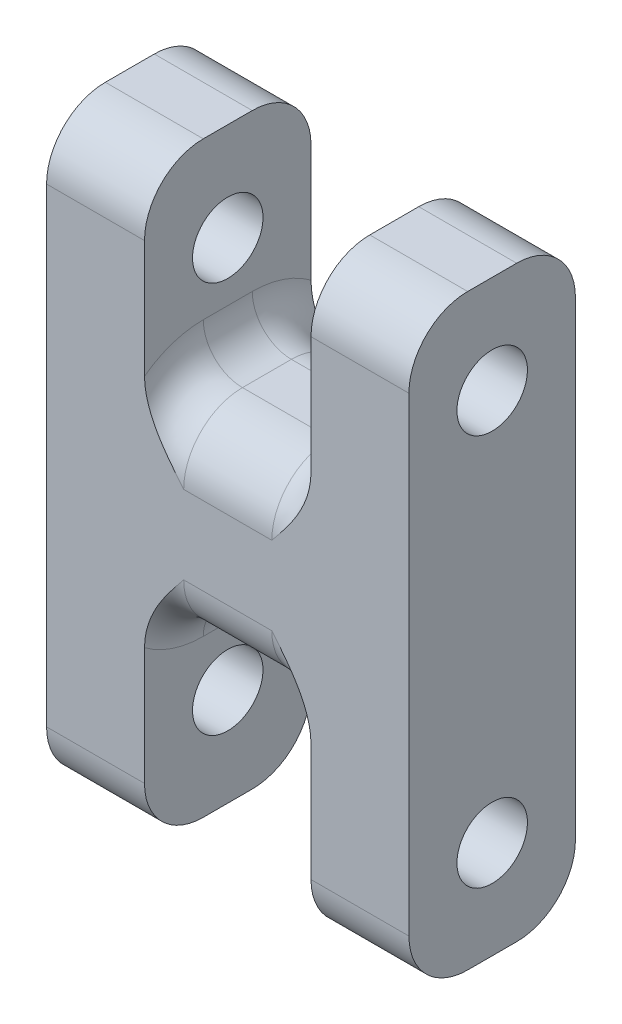
from build123d import *

# Parameters (mm, degrees)
ESQUISSE1_W             = 5
ESQUISSE1_H             = 30
ESQUISSE1_W_2           = 8.5
ESQUISSE1_H_2           = 10
BOSS_EXTRU_1_DEPTH      = 8.5
ESQUISSE2_R             = 1.8
ENL_V_MAT_EXTRU_1_DEPTH = 20
CONG_3_R                = 3
CONG_1_R                = 2


with BuildPart() as part:
    # Esquisse1 → Boss.-Extru.1 (new body)
    with BuildSketch(Plane.XY):
        with Locations((2.5, 15)):
            Rectangle(ESQUISSE1_W, ESQUISSE1_H)
        with Locations((16, 15)):
            Rectangle(ESQUISSE1_W, ESQUISSE1_H)
        with Locations((9.25, 15)):
            Rectangle(ESQUISSE1_W_2, ESQUISSE1_H_2)
    extrude(amount=BOSS_EXTRU_1_DEPTH)

    # Esquisse2 → Enlèv. mat.-Extru.1 (cut)
    with BuildSketch(Plane(origin=(18.5, 0, 0), x_dir=(0, 0, -1), z_dir=(1, 0, 0))):
        with Locations(Location((-4.25, 25, 0), (0, 0, 90))):
            Circle(ESQUISSE2_R)
        with Locations(Location((-4.25, 5, 0), (0, 0, 90))):
            Circle(ESQUISSE2_R)
    extrude(amount=-ENL_V_MAT_EXTRU_1_DEPTH, mode=Mode.SUBTRACT)

    # Congé3
    cong_3_edges = [part.edges().sort_by_distance(p)[0] for p in [
        (2.5, 30, 8.5),
        (9.25, 20, 0),
        (16, 30, 0),
        (16, 0, 0),
        (9.25, 10, 0),
        (2.5, 0, 0),
        (2.5, 30, 0),
        (2.5, 0, 8.5),
        (9.25, 10, 8.5),
        (16, 0, 8.5),
        (16, 30, 8.5),
        (9.25, 20, 8.5),
    ]]
    fillet(cong_3_edges, radius=CONG_3_R)

    # Congé1
    # the kernel refuses this fillet: 2 mm, written as the material it adds along each edge
    with BuildSketch(Plane(origin=(13.5, 10, 3), x_dir=(0, -1, 0), z_dir=(0, 0, 1)), Plane(origin=(5, 20, 3), x_dir=(0, 1, 0), z_dir=(0, 0, 1))) as cong_1_piece_1:
        with BuildLine():
            CenterArc((CONG_1_R, -CONG_1_R), CONG_1_R, 90, 90)
            Line((0, -CONG_1_R), (0, 0))
            Line((0, 0), (CONG_1_R, 0))
        make_face()
    extrude(amount=2.5)
    with BuildSketch(Plane(origin=(13.5, 17, 3), x_dir=(0, -0.9953436464450918, 0.09638996566753391), z_dir=(0, 0.09638996566753391, 0.9953436464450918))) as cong_1_piece_2_section:
        with BuildLine():
            CenterArc((3 + CONG_1_R, -CONG_1_R), CONG_1_R, 90, 90)
            Line((3, -CONG_1_R), (3, 0))
            Line((3, 0), (3 + CONG_1_R, 0))
        make_face()
    cong_1_piece_2 = revolve(axis=Axis((13.5, 17, 3), (1, 0, 0)), revolution_arc=185.531326158, mode=Mode.PRIVATE)
    cong_1_piece_2 = split(cong_1_piece_2, bisect_by=Plane(origin=(12.926399559, 19.220886719, 0), z_dir=(0, 0, 1)), keep=Keep.TOP, mode=Mode.PRIVATE)
    add(cong_1_piece_2)
    with BuildSketch(Plane(origin=(5, 17, 3), x_dir=(0, -0.9953436464450918, 0.09638996566753227), z_dir=(0, 0.09638996566753227, 0.9953436464450918))) as cong_1_piece_3_section:
        with BuildLine():
            CenterArc((3 + CONG_1_R, CONG_1_R), CONG_1_R, 180, 90)
            Line((3 + CONG_1_R, 0), (3, 0))
            Line((3, 0), (3, CONG_1_R))
        make_face()
    cong_1_piece_3 = revolve(axis=Axis((5, 17, 3), (1, 0, 0)), revolution_arc=185.531326158, mode=Mode.PRIVATE)
    cong_1_piece_3 = split(cong_1_piece_3, bisect_by=Plane(origin=(5.573600437, 19.220886663, 0), z_dir=(0, 0, 1)), keep=Keep.TOP, mode=Mode.PRIVATE)
    add(cong_1_piece_3)
    with BuildSketch(Plane(origin=(13.5, 13, 3), x_dir=(0, 0.9953436464450918, 0.09638996566753272), z_dir=(0, -0.09638996566753272, 0.9953436464450918))) as cong_1_piece_4_section:
        with BuildLine():
            CenterArc((3 + CONG_1_R, CONG_1_R), CONG_1_R, 180, 90)
            Line((3 + CONG_1_R, 0), (3, 0))
            Line((3, 0), (3, CONG_1_R))
        make_face()
    cong_1_piece_4 = revolve(axis=Axis((13.5, 13, 3), (-1, 0, 0)), revolution_arc=185.531326158, mode=Mode.PRIVATE)
    cong_1_piece_4 = split(cong_1_piece_4, bisect_by=Plane(origin=(12.926399561, 10.779113284, 0), z_dir=(0, 0, 1)), keep=Keep.TOP, mode=Mode.PRIVATE)
    add(cong_1_piece_4)
    with BuildSketch(Plane(origin=(5, 13, 3), x_dir=(0, 0.9953436464450918, 0.09638996566753391), z_dir=(0, -0.09638996566753391, 0.9953436464450918))) as cong_1_piece_5_section:
        with BuildLine():
            CenterArc((3 + CONG_1_R, -CONG_1_R), CONG_1_R, 90, 90)
            Line((3, -CONG_1_R), (3, 0))
            Line((3, 0), (3 + CONG_1_R, 0))
        make_face()
    cong_1_piece_5 = revolve(axis=Axis((5, 13, 3), (-1, 0, 0)), revolution_arc=185.531326158, mode=Mode.PRIVATE)
    cong_1_piece_5 = split(cong_1_piece_5, bisect_by=Plane(origin=(5.573600429, 10.779113281, 0), z_dir=(0, 0, 1)), keep=Keep.TOP, mode=Mode.PRIVATE)
    add(cong_1_piece_5)
    with BuildSketch(Plane(origin=(13.5, 17, 5.5), x_dir=(0, -0.9953436464450917, -0.09638996566753434), z_dir=(0, 0.09638996566753434, -0.9953436464450917))) as cong_1_piece_6_section:
        with BuildLine():
            CenterArc((3 + CONG_1_R, CONG_1_R), CONG_1_R, 180, 90)
            Line((3, CONG_1_R), (3, 0))
            Line((3, 0), (3 + CONG_1_R, 0))
        make_face()
    cong_1_piece_6 = revolve(axis=Axis((13.5, 17, 5.5), (-1, 0, 0)), revolution_arc=185.531326158, mode=Mode.PRIVATE)
    cong_1_piece_6 = split(cong_1_piece_6, bisect_by=Plane(origin=(12.92639966, 19.220886752, 8.5), z_dir=(0, 0, -1)), keep=Keep.TOP, mode=Mode.PRIVATE)
    add(cong_1_piece_6)
    with BuildSketch(Plane(origin=(5, 17, 5.5), x_dir=(0, -0.9953436464450918, -0.09638996566753258), z_dir=(0, 0.09638996566753258, -0.9953436464450918))) as cong_1_piece_7_section:
        with BuildLine():
            CenterArc((3 + CONG_1_R, -CONG_1_R), CONG_1_R, 90, 90)
            Line((3, -CONG_1_R), (3, 0))
            Line((3, 0), (3 + CONG_1_R, 0))
        make_face()
    cong_1_piece_7 = revolve(axis=Axis((5, 17, 5.5), (-1, 0, 0)), revolution_arc=185.531326158, mode=Mode.PRIVATE)
    cong_1_piece_7 = split(cong_1_piece_7, bisect_by=Plane(origin=(5.573251137, 19.22118781, 8.5), z_dir=(0, 0, -1)), keep=Keep.TOP, mode=Mode.PRIVATE)
    add(cong_1_piece_7)
    with BuildSketch(Plane(origin=(13.5, 13, 5.5), x_dir=(0, 0.9953436464450918, -0.09638996566753316), z_dir=(0, -0.09638996566753316, -0.9953436464450918))) as cong_1_piece_8_section:
        with BuildLine():
            CenterArc((3 + CONG_1_R, -CONG_1_R), CONG_1_R, 90, 90)
            Line((3, -CONG_1_R), (3, 0))
            Line((3, 0), (3 + CONG_1_R, 0))
        make_face()
    cong_1_piece_8 = revolve(axis=Axis((13.5, 13, 5.5), (1, 0, 0)), revolution_arc=185.531326158, mode=Mode.PRIVATE)
    cong_1_piece_8 = split(cong_1_piece_8, bisect_by=Plane(origin=(12.926652362, 10.77922389, 8.5), z_dir=(0, 0, -1)), keep=Keep.TOP, mode=Mode.PRIVATE)
    add(cong_1_piece_8)
    with BuildSketch(Plane(origin=(5, 13, 5.5), x_dir=(0, 0.9953436464450917, -0.09638996566753434), z_dir=(0, -0.09638996566753434, -0.9953436464450917))) as cong_1_piece_9_section:
        with BuildLine():
            CenterArc((3 + CONG_1_R, CONG_1_R), CONG_1_R, 180, 90)
            Line((3, CONG_1_R), (3, 0))
            Line((3, 0), (3 + CONG_1_R, 0))
        make_face()
    cong_1_piece_9 = revolve(axis=Axis((5, 13, 5.5), (1, 0, 0)), revolution_arc=185.531326158, mode=Mode.PRIVATE)
    cong_1_piece_9 = split(cong_1_piece_9, bisect_by=Plane(origin=(5.573600352, 10.779113305, 8.5), z_dir=(0, 0, -1)), keep=Keep.TOP, mode=Mode.PRIVATE)
    add(cong_1_piece_9)
    with BuildSketch(Plane(origin=(13.5, 20, 3), x_dir=(0, 1, 0), z_dir=(0, 0, 1)), Plane(origin=(5, 10, 3), x_dir=(0, -1, 0), z_dir=(0, 0, 1))) as cong_1_piece_10:
        with BuildLine():
            CenterArc((CONG_1_R, CONG_1_R), CONG_1_R, 180, 90)
            Line((0, CONG_1_R), (0, 0))
            Line((0, 0), (CONG_1_R, 0))
        make_face()
    extrude(amount=2.5)


solid = part.part
